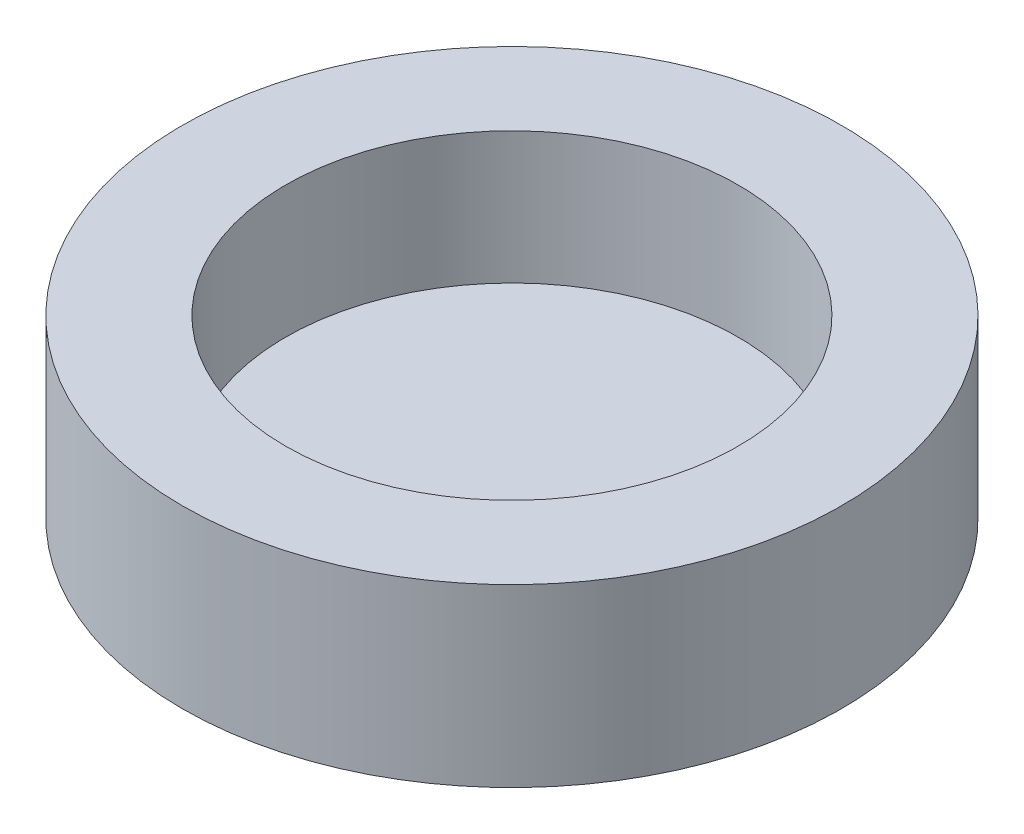
from build123d import *

# Parameters (mm, degrees)
SKETCH1_R           = 7.5
BOSS_EXTRUDE1_DEPTH = 4
SKETCH2_R           = 5.15
CUT_EXTRUDE1_DEPTH  = 3


with BuildPart() as part:
    # Sketch1 → Boss-Extrude1 (new body)
    with BuildSketch(Plane(origin=(0, 0, 0), x_dir=(1, 0, 0), z_dir=(0, 1, 0))):
        Circle(SKETCH1_R)
    extrude(amount=BOSS_EXTRUDE1_DEPTH)

    # Sketch2 → Cut-Extrude1 (cut)
    with BuildSketch(Plane(origin=(0, 4, 0), x_dir=(1, 0, 0), z_dir=(0, 1, 0))):
        Circle(SKETCH2_R)
    extrude(amount=-CUT_EXTRUDE1_DEPTH, mode=Mode.SUBTRACT)


solid = part.part
